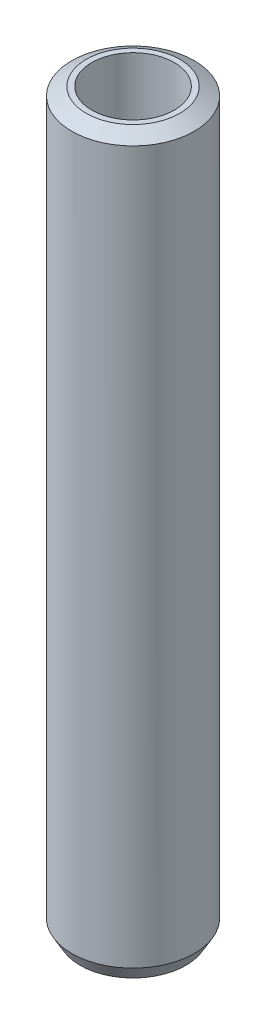
from build123d import *
from OCP.BRepFilletAPI import BRepFilletAPI_MakeChamfer

# Parameters (mm, degrees)
SKETCH1_R           = 12.5
BOSS_EXTRUDE1_DEPTH = 149.965844448
SKETCH2_R           = 8.42113264
CUT_EXTRUDE1_DEPTH  = 152.004153919
CHAMFER1_SIZE       = 1.700950596
CHAMFER1_SIZE2      = 2.946132854


with BuildPart() as part:
    # Sketch1 → Boss-Extrude1 (new body)
    with BuildSketch(Plane(origin=(0, 0, 0), x_dir=(1, 0, 0), z_dir=(0, 1, 0))):
        Circle(SKETCH1_R)
    extrude(amount=BOSS_EXTRUDE1_DEPTH)

    # Sketch2 → Cut-Extrude1 (cut, through all)
    with BuildSketch(Plane(origin=(0, 0, 0), x_dir=(1, 0, 0), z_dir=(0, 1, 0))):
        Circle(SKETCH2_R)
    extrude(amount=CUT_EXTRUDE1_DEPTH, mode=Mode.SUBTRACT)

    # Chamfer1: one chamfer whose edges measure the first distance from different faces: ONE call of the kernel's chamfer builder (chamfer() names one face for all edges)
    chamfer1_edges_1 = [part.edges().sort_by_distance(p)[0] for p in [
        (-12.5, 149.965844448, 0),
    ]]
    chamfer1_side_1 = [part.faces().sort_by_distance(p)[0] for p in [
        (-12.5, 74.982922224, 0),
    ]]
    chamfer1_edges_2 = [part.edges().sort_by_distance(p)[0] for p in [
        (-12.5, 0, 0),
    ]]
    chamfer1_side_2 = [part.faces().sort_by_distance(p)[0] for p in [
        (-12.146446609, 0, 0),
    ]]
    chamfer1 = BRepFilletAPI_MakeChamfer(part.part.solid().wrapped)
    for e in chamfer1_edges_1:
        chamfer1.Add(CHAMFER1_SIZE, CHAMFER1_SIZE2, e.wrapped, chamfer1_side_1[0].wrapped)  # the first distance lies on this face
    for e in chamfer1_edges_2:
        chamfer1.Add(CHAMFER1_SIZE, CHAMFER1_SIZE2, e.wrapped, chamfer1_side_2[0].wrapped)  # the first distance lies on this face
    add(Compound.cast(chamfer1.Shape()), mode=Mode.REPLACE)


solid = part.part
